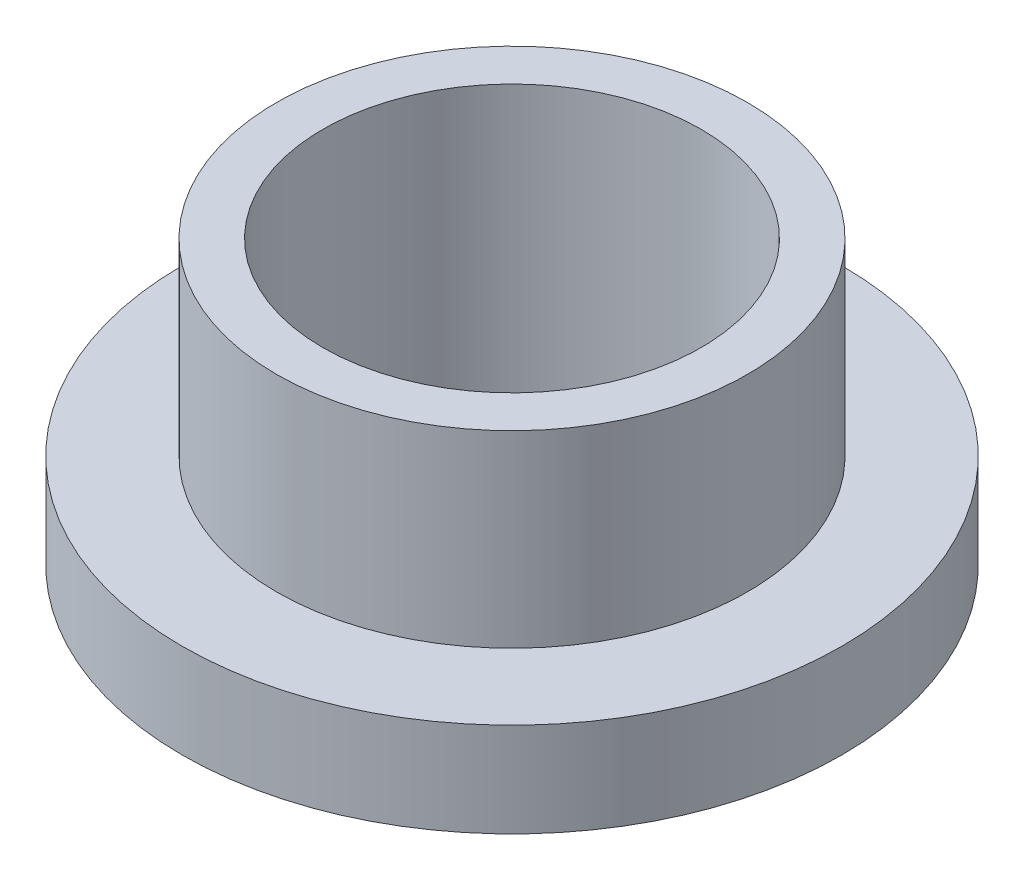
from build123d import *

# Parameters (mm, degrees)
SKETCH2_R           = 7.9375
SKETCH2_R_2         = 6.3754
BOSS_EXTRUDE1_DEPTH = 9.525
SKETCH3_R           = 11.1125
SKETCH3_R_2         = 7.9375
BOSS_EXTRUDE2_DEPTH = 3.175


with BuildPart() as part:
    # Sketch2 → Boss-Extrude1 (new body)
    with BuildSketch(Plane(origin=(0, 0, 0), x_dir=(1, 0, 0), z_dir=(0, 1, 0))):
        Circle(SKETCH2_R)
        Circle(SKETCH2_R_2, mode=Mode.SUBTRACT)
    extrude(amount=BOSS_EXTRUDE1_DEPTH)

    # Sketch3 → Boss-Extrude2 (add)
    with BuildSketch(Plane(origin=(0, 0, 0), x_dir=(1, 0, 0), z_dir=(0, 1, 0))):
        Circle(SKETCH3_R)
        Circle(SKETCH3_R_2, mode=Mode.SUBTRACT)
    extrude(amount=BOSS_EXTRUDE2_DEPTH)


solid = part.part
